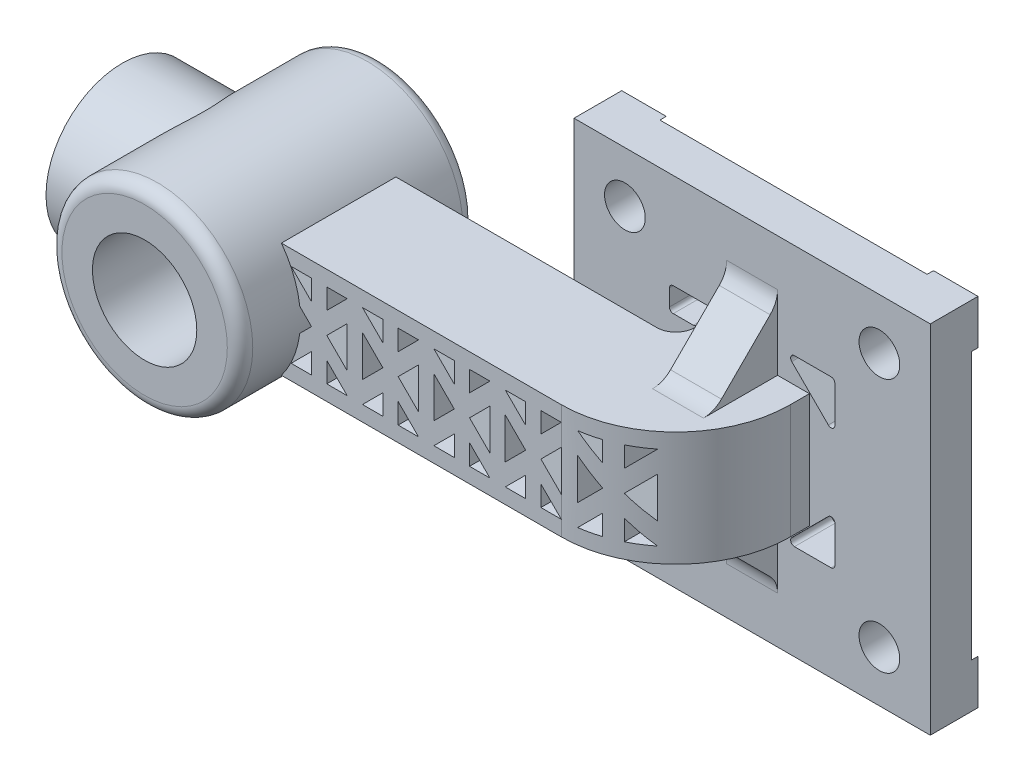
from build123d import *

# Parameters (mm, degrees)
SKETCH1_W            = 28
SKETCH1_H            = 28
BOSS_EXTRUDE1_DEPTH  = 3.25
SKETCH3_R            = 1.6
CUT_EXTRUDE1_DEPTH   = 40.731127595
SKETCH4_W            = 13
SKETCH4_H            = 2.5
SKETCH4_W_2          = 2.5
SKETCH4_H_2          = 13
BOSS_EXTRUDE3_DEPTH  = 0.5
SKETCH5_W            = 9
SKETCH5_H            = 9
BOSS_EXTRUDE4_DEPTH  = 10.5
SKETCH6_W            = 9
SKETCH6_H            = 9
BOSS_EXTRUDE5_DEPTH  = 28
FILLET1_R            = 9
FILLET2_R            = 1.5
SKETCH8_R            = 6
BOSS_EXTRUDE7_DEPTH  = 11
CUT_EXTRUDE4_DEPTH   = 9
SKETCH7_R            = 7.5
BOSS_EXTRUDE8_DEPTH  = 18.5
SKETCH9_R            = 4.1
CUT_EXTRUDE2_DEPTH   = 45.891536016
SKETCH11_R           = 2.5
CUT_EXTRUDE3_DEPTH   = 9
BOSS_EXTRUDE10_START = 12
BOSS_EXTRUDE10_DEPTH = 4
FILLET3_R            = 2
BOSS_EXTRUDE11_START = -3
SKETCH15_W           = 8.932771519
SKETCH15_H           = 1.5
BOSS_EXTRUDE11_DEPTH = 3
FILLET4_R            = 1
FILLET5_R            = 1
CUT_EXTRUDE5_DEPTH   = 10
FILLET6_R            = 0.3
SKETCH20_R           = 3.5
CUT_EXTRUDE6_DEPTH   = 0.5
BOSS_EXTRUDE12_DEPTH = 0.5


with BuildPart() as part:
    # Sketch1 → Boss-Extrude1 (new body)
    with BuildSketch(Plane.XY):
        with Locations((14, 14)):
            Rectangle(SKETCH1_W, SKETCH1_H)
    extrude(amount=BOSS_EXTRUDE1_DEPTH)

    # Sketch3 → Cut-Extrude1 (cut, through all)
    with BuildSketch(Plane(origin=(0, 0, 0), x_dir=(-1, 0, 0), z_dir=(0, 0, -1))):
        with Locations((-24, 24)):
            Circle(SKETCH3_R)
        with Locations((-4, 24)):
            Circle(SKETCH3_R)
        with Locations((-4, 4)):
            Circle(SKETCH3_R)
        with Locations((-24, 4)):
            Circle(SKETCH3_R)
    extrude(amount=-CUT_EXTRUDE1_DEPTH, mode=Mode.SUBTRACT)

    # Sketch4 → Boss-Extrude3 (add)
    with BuildSketch(Plane(origin=(0, 0, 0), x_dir=(-1, 0, 0), z_dir=(0, 0, -1))):
        with Locations((-14, 24.25)):
            Rectangle(SKETCH4_W, SKETCH4_H)
        with Locations((-3.75, 14)):
            Rectangle(SKETCH4_W_2, SKETCH4_H_2)
        with Locations((-14, 3.75)):
            Rectangle(SKETCH4_W, SKETCH4_H)
        with Locations((-24.25, 14)):
            Rectangle(SKETCH4_W_2, SKETCH4_H_2)
    extrude(amount=BOSS_EXTRUDE3_DEPTH)

    # Sketch5 → Boss-Extrude4 (add)
    with BuildSketch(Plane.XY.offset(3.25)):
        with Locations((14, 14)):
            Rectangle(SKETCH5_W, SKETCH5_H)
    extrude(amount=BOSS_EXTRUDE4_DEPTH)

    # Sketch6 → Boss-Extrude5 (add)
    with BuildSketch(Plane.ZY.offset(-9.5)):
        with Locations((9.25, 14)):
            Rectangle(SKETCH6_W, SKETCH6_H)
    extrude(amount=BOSS_EXTRUDE5_DEPTH)

    # Fillet1
    fillet1_edges = [part.edges().sort_by_distance(p)[0] for p in [
        (18.5, 14, 13.75),
    ]]
    fillet(fillet1_edges, radius=FILLET1_R)

    # Fillet2
    fillet2_edges = [part.edges().sort_by_distance(p)[0] for p in [
        (9.5, 14, 4.75),
    ]]
    fillet(fillet2_edges, radius=FILLET2_R - 0.0001)  # a hair under: the kernel refuses the full size

    # Sketch8 → Boss-Extrude7 (add)
    with BuildSketch(Plane.ZY.offset(18.5)):
        with Locations(Location((9.25, 14, 0), (0, 0, 138.590377891))):
            Circle(SKETCH8_R)
    extrude(amount=BOSS_EXTRUDE7_DEPTH)

    # Sketch18 → Cut-Extrude4 (cut)
    with BuildSketch(Plane.XY.offset(13.75)):
        Polygon((9.5, 12.397056275), (9.5, 15.602943725), (7.897056275, 14), align=None)
        Polygon((7.897056275, 15.697056275), (9.5, 17.3), (7.897056275, 17.3), align=None)
        Polygon((9.5, 10.7), (7.897056275, 10.7), (7.897056275, 12.302943725), align=None)
        Polygon((6.697056275, 17.3), (6.697056275, 15.697056275), (5.09411255, 17.3), align=None)
        Polygon((6.697056275, 14), (5.09411255, 15.602943725), (5.09411255, 12.397056275), align=None)
        Polygon((5.09411255, 10.7), (6.697056275, 10.7), (6.697056275, 12.302943725), align=None)
        Polygon((3.89, 12.397056275), (3.89, 15.602943725), (2.287056275, 14), align=None)
        Polygon((2.287056275, 15.697056275), (3.89, 17.3), (2.287056275, 17.3), align=None)
        Polygon((3.89, 10.7), (2.287056275, 10.7), (2.287056275, 12.302943725), align=None)
        Polygon((1.087056275, 17.3), (1.087056275, 15.697056275), (-0.51588745, 17.3), align=None)
        Polygon((1.087056275, 14), (-0.51588745, 15.602943725), (-0.51588745, 12.397056275), align=None)
        Polygon((-0.51588745, 10.7), (1.087056275, 10.7), (1.087056275, 12.302943725), align=None)
        Polygon((-1.72, 12.397056275), (-1.72, 15.602943725), (-3.322943725, 14), align=None)
        Polygon((-3.322943725, 15.697056275), (-1.72, 17.3), (-3.322943725, 17.3), align=None)
        Polygon((-1.72, 10.7), (-3.322943725, 10.7), (-3.322943725, 12.302943725), align=None)
        Polygon((-4.522943725, 17.3), (-4.522943725, 15.697056275), (-6.12588745, 17.3), align=None)
        Polygon((-4.522943725, 14), (-6.12588745, 15.602943725), (-6.12588745, 12.397056275), align=None)
        Polygon((-6.12588745, 10.7), (-4.522943725, 10.7), (-4.522943725, 12.302943725), align=None)
        Polygon((-7.33, 12.397056275), (-7.33, 15.602943725), (-8.932943725, 14), align=None)
        Polygon((-8.932943725, 15.697056275), (-7.33, 17.3), (-8.932943725, 17.3), align=None)
        Polygon((-7.33, 10.7), (-8.932943725, 10.7), (-8.932943725, 12.302943725), align=None)
        Polygon((-10.132943725, 17.3), (-10.132943725, 15.697056275), (-11.73588745, 17.3), align=None)
        Polygon((-10.132943725, 14), (-11.73588745, 15.602943725), (-11.73588745, 12.397056275), align=None)
        Polygon((-11.73588745, 10.7), (-10.132943725, 10.7), (-10.132943725, 12.302943725), align=None)
        Polygon((15.11, 12.397056275), (15.11, 15.602943725), (13.507056275, 14), align=None)
        Polygon((13.507056275, 15.697056275), (15.11, 17.3), (13.507056275, 17.3), align=None)
        Polygon((15.11, 10.7), (13.507056275, 10.7), (13.507056275, 12.302943725), align=None)
        Polygon((12.307056275, 17.3), (12.307056275, 15.697056275), (10.70411255, 17.3), align=None)
        Polygon((12.307056275, 14), (10.70411255, 15.602943725), (10.70411255, 12.397056275), align=None)
        Polygon((10.70411255, 10.7), (12.307056275, 10.7), (12.307056275, 12.302943725), align=None)
    extrude(amount=-CUT_EXTRUDE4_DEPTH, mode=Mode.SUBTRACT)

    # Sketch7 → Boss-Extrude8 (add)
    with BuildSketch(Plane.XY):
        with Locations((-18.5, 14)):
            Circle(SKETCH7_R)
    extrude(amount=BOSS_EXTRUDE8_DEPTH)

    # Sketch9 → Cut-Extrude2 (cut, through all)
    with BuildSketch(Plane.XY.offset(18.5)):
        with Locations((-18.5, 14)):
            Circle(SKETCH9_R)
    extrude(amount=-CUT_EXTRUDE2_DEPTH, mode=Mode.SUBTRACT)

    # Sketch11 → Cut-Extrude3 (cut)
    with BuildSketch(Plane.ZY.offset(29.5)):
        with Locations((9.25, 14)):
            Circle(SKETCH11_R)
    extrude(amount=-CUT_EXTRUDE3_DEPTH, mode=Mode.SUBTRACT)

    # Sketch14 → Boss-Extrude10 (add)
    with BuildSketch(Plane(origin=(0, 0, 0), x_dir=(0, 0, -1), z_dir=(1, 0, 0)).offset(BOSS_EXTRUDE10_START)):
        Polygon((-8.25, 18.5), (-3.25, 23.5), (-3.25, 18.5), align=None)
        Polygon((-8.25, 9.5), (-3.25, 4.5), (-3.25, 9.5), align=None)
    extrude(amount=BOSS_EXTRUDE10_DEPTH)

    # Fillet3
    fillet3_edges = [part.edges().sort_by_distance(p)[0] for p in [
        (14, 18.5, 8.25),
        (14, 23.5, 3.25),
        (14, 9.5, 8.25),
        (14, 4.5, 3.25),
    ]]
    fillet(fillet3_edges, radius=FILLET3_R)

    # Sketch15 → Boss-Extrude11 (add)
    with BuildSketch(Plane.XZ.offset(-9.5).offset(BOSS_EXTRUDE11_START)):
        with Locations((6.283614241, 4)):
            Rectangle(SKETCH15_W, SKETCH15_H)
    extrude(amount=-BOSS_EXTRUDE11_DEPTH)

    # Fillet4
    fillet4_edges = [part.edges().sort_by_distance(p)[0] for p in [
        (-26, 14, 0),
    ]]
    fillet(fillet4_edges, radius=FILLET4_R)

    # Fillet5
    fillet5_edges = [part.edges().sort_by_distance(p)[0] for p in [
        (-26, 14, 18.5),
    ]]
    fillet(fillet5_edges, radius=FILLET5_R)

    # Sketch19 → Cut-Extrude5 (cut)
    with BuildSketch(Plane(origin=(0, 0, 0), x_dir=(-1, 0, 0), z_dir=(0, 0, -1))):
        Polygon((-20.5, 20.5), (-20.5, 16.6), (-16.6, 20.5), align=None)
        Polygon((-20.5, 7.5), (-20.5, 11.4), (-16.6, 7.5), align=None)
        Polygon((-7.5, 7.5), (-11.4, 7.5), (-9.5, 9.4), (-7.5, 9.4), align=None)
        Polygon((-11.4, 20.5), (-7.5, 20.5), (-7.5, 18.6), (-9.5, 18.6), align=None)
    extrude(amount=-CUT_EXTRUDE5_DEPTH, mode=Mode.SUBTRACT)

    # Fillet6
    fillet6_edges = [part.edges().sort_by_distance(p)[0] for p in [
        (7.5, 18.6, 1.625),
        (9.5, 18.6, 1.625),
        (11.4, 20.5, 1.625),
        (7.5, 20.5, 1.625),
        (16.6, 7.5, 1.625),
        (20.5, 7.5, 1.625),
        (20.5, 11.4, 1.625),
        (7.5, 9.4, 1.625),
        (7.5, 7.5, 1.625),
        (11.4, 7.5, 1.625),
        (9.5, 9.4, 1.625),
        (20.5, 20.5, 1.625),
        (16.6, 20.5, 1.625),
        (20.5, 16.6, 1.625),
    ]]
    fillet(fillet6_edges, radius=FILLET6_R)

    # Sketch20 → Cut-Extrude6 (cut)
    with BuildSketch(Plane(origin=(0, 0, 0), x_dir=(-1, 0, 0), z_dir=(0, 0, -1))):
        with Locations((-14, 14)):
            Circle(SKETCH20_R)
    extrude(amount=-CUT_EXTRUDE6_DEPTH, mode=Mode.SUBTRACT)

    # Sketch21 → Boss-Extrude12 (add)
    with BuildSketch(Plane(origin=(0, 0, 0), x_dir=(-1, 0, 0), z_dir=(0, 0, -1))):
        Polygon((-28, 28), (-28, 24.5), (-24.5, 28), align=None)
        Polygon((-3.5, 28), (0, 24.5), (0, 28), align=None)
        Polygon((-3.5, 0), (0, 0), (0, 3.5), align=None)
        Polygon((-28, 0), (-28, 3.5), (-24.5, 0), align=None)
    extrude(amount=BOSS_EXTRUDE12_DEPTH)


solid = part.part
